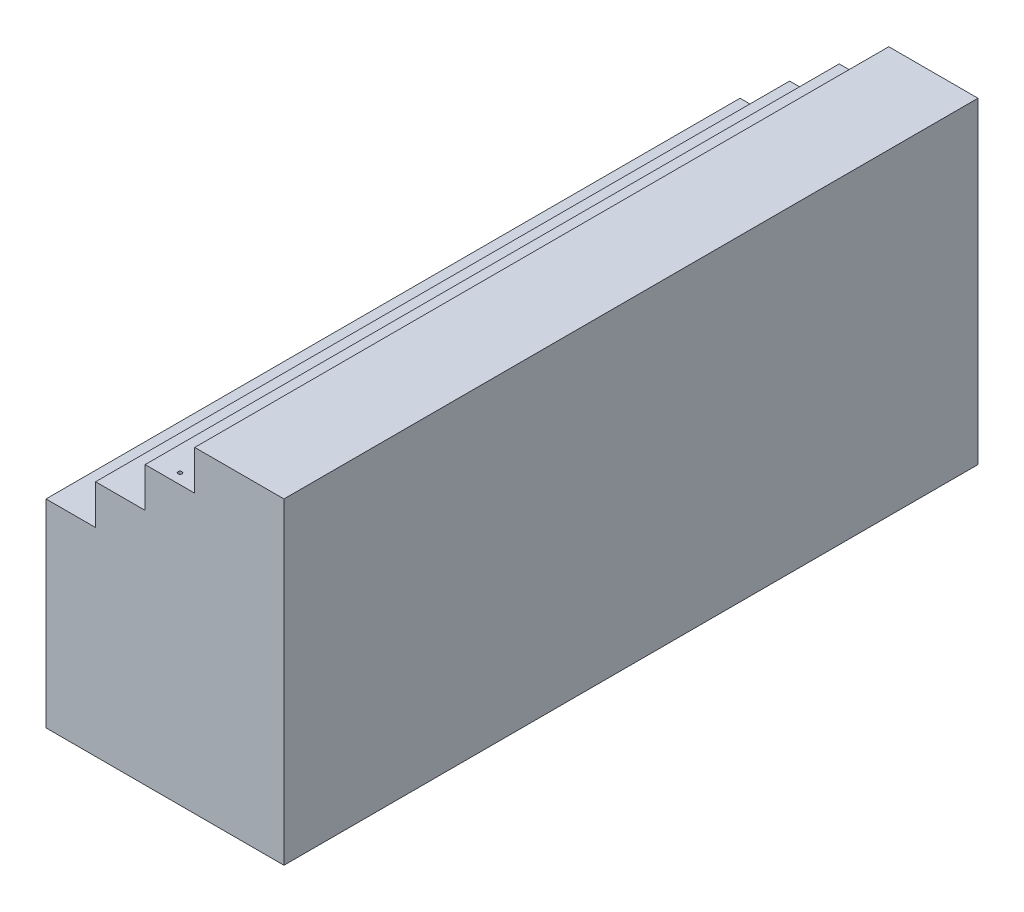
from build123d import *

# Parameters (mm, degrees)
SKETCH_1_W           = 250
SKETCH_1_H           = 3500
EXTRUDE_1_DEPTH      = 1000
SKETCH_1_3_W         = 250
SKETCH_1_3_H         = 3500
EXTRUDE_2_DEPTH      = 1200
SKETCH_1_4_W         = 250
SKETCH_1_4_H         = 3500
EXTRUDE_3_DEPTH      = 1400
SKETCH_1_5_W         = 390
SKETCH_1_5_H         = 3500
EXTRUDE_4_DEPTH      = 1600
SKETCH_1_6_W         = 60
SKETCH_1_6_H         = 3500
EXTRUDE_5_DEPTH      = 1600
SKETCH_2_R           = 10
SKETCH_2_R_2         = 12.335954766
CUT_EXTRUDE_1_DEPTH  = 230
SKETCH_10_R          = 10
SKETCH_10_R_2        = 12.335954766
CUT_EXTRUDE_8_DEPTH  = 230
SKETCH_16_R          = 10
SKETCH_16_R_2        = 12.335954766
CUT_EXTRUDE_14_DEPTH = 230


with BuildPart() as part:
    # Эскиз1 → Бобышка-Вытянуть1 (new body)
    with BuildSketch(Plane(origin=(0, 0, 0), x_dir=(1, 0, 0), z_dir=(0, 1, 0))):
        with Locations((125, 1750)):
            Rectangle(SKETCH_1_W, SKETCH_1_H)
    extrude(amount=EXTRUDE_1_DEPTH)

    # Эскиз1<3> → Бобышка-Вытянуть2 (add)
    with BuildSketch(Plane(origin=(0, 0, 0), x_dir=(1, 0, 0), z_dir=(0, 1, 0))):
        with Locations((375, 1750)):
            Rectangle(SKETCH_1_3_W, SKETCH_1_3_H)
    extrude(amount=EXTRUDE_2_DEPTH)

    # Эскиз1<4> → Бобышка-Вытянуть3 (add)
    with BuildSketch(Plane(origin=(0, 0, 0), x_dir=(1, 0, 0), z_dir=(0, 1, 0))):
        with Locations((625, 1750)):
            Rectangle(SKETCH_1_4_W, SKETCH_1_4_H)
    extrude(amount=EXTRUDE_3_DEPTH)

    # Эскиз1<5> → Бобышка-Вытянуть4 (add)
    with BuildSketch(Plane(origin=(0, 0, 0), x_dir=(1, 0, 0), z_dir=(0, 1, 0))):
        with Locations((945, 1750)):
            Rectangle(SKETCH_1_5_W, SKETCH_1_5_H)
    extrude(amount=EXTRUDE_4_DEPTH)

    # Эскиз1<6> → Бобышка-Вытянуть5 (add)
    with BuildSketch(Plane(origin=(0, 0, 0), x_dir=(1, 0, 0), z_dir=(0, 1, 0))):
        with Locations((1170, 1750)):
            Rectangle(SKETCH_1_6_W, SKETCH_1_6_H)
    extrude(amount=EXTRUDE_5_DEPTH)

    # Эскиз2 → Вырез-Вытянуть1 (cut)
    with BuildSketch(Plane(origin=(0, 1400, 0), x_dir=(1, 0, 0), z_dir=(0, 1, 0))):
        with Locations((625, 3357.152132265)):
            Circle(SKETCH_2_R)
        with Locations((625, 3243.136997035)):
            Circle(SKETCH_2_R)
        with Locations((625, 3145.792962986)):
            Circle(SKETCH_2_R)
        with Locations((625, 3016.463867162)):
            Circle(SKETCH_2_R)
        with Locations((625, 2886.892438707)):
            Circle(SKETCH_2_R)
        with Locations((625, 2776.185031262)):
            Circle(SKETCH_2_R)
        with Locations((625, 2652.112531743)):
            Circle(SKETCH_2_R)
        with Locations((625, 2528.615192208)):
            Circle(SKETCH_2_R)
        with Locations((625, 2426.866506998)):
            Circle(SKETCH_2_R)
        with Locations((625, 2323.054011053)):
            Circle(SKETCH_2_R)
        with Locations((625, 2236.363113826)):
            Circle(SKETCH_2_R_2)
    extrude(amount=-CUT_EXTRUDE_1_DEPTH, mode=Mode.SUBTRACT)

    # Эскиз10 → Вырез-Вытянуть8 (cut)
    with BuildSketch(Plane(origin=(0, 1400, 0), x_dir=(1, 0, 0), z_dir=(0, 1, 0))):
        with Locations((632.852016255, 2116.617341228)):
            Circle(SKETCH_10_R)
        with Locations((632.852016255, 2002.602205997)):
            Circle(SKETCH_10_R)
        with Locations((632.852016255, 1905.258171949)):
            Circle(SKETCH_10_R)
        with Locations((632.852016255, 1775.929076125)):
            Circle(SKETCH_10_R)
        with Locations((632.852016255, 1646.35764767)):
            Circle(SKETCH_10_R)
        with Locations((632.852016255, 1535.650240224)):
            Circle(SKETCH_10_R)
        with Locations((632.852016255, 1411.577740705)):
            Circle(SKETCH_10_R)
        with Locations((632.852016255, 1288.08040117)):
            Circle(SKETCH_10_R)
        with Locations((632.852016255, 1186.33171596)):
            Circle(SKETCH_10_R)
        with Locations((632.852016255, 1082.519220016)):
            Circle(SKETCH_10_R)
        with Locations((632.852016255, 995.828322788)):
            Circle(SKETCH_10_R_2)
    extrude(amount=-CUT_EXTRUDE_8_DEPTH, mode=Mode.SUBTRACT)

    # Эскиз16 → Вырез-Вытянуть14 (cut)
    with BuildSketch(Plane(origin=(0, 1400, 0), x_dir=(1, 0, 0), z_dir=(0, 1, 0))):
        with Locations((623.672758158, 880.722913646)):
            Circle(SKETCH_16_R)
        with Locations((623.672758158, 766.707778415)):
            Circle(SKETCH_16_R)
        with Locations((623.672758158, 669.363744367)):
            Circle(SKETCH_16_R)
        with Locations((623.672758158, 540.034648543)):
            Circle(SKETCH_16_R)
        with Locations((623.672758158, 410.463220088)):
            Circle(SKETCH_16_R)
        with Locations((623.672758158, 299.755812642)):
            Circle(SKETCH_16_R)
        with Locations((623.672758158, 175.683313124)):
            Circle(SKETCH_16_R)
        with Locations((623.672758158, 52.185973589)):
            Circle(SKETCH_16_R)
        with Locations((623.672758158, -49.562711622)):
            Circle(SKETCH_16_R)
        with Locations((623.672758158, -153.375207566)):
            Circle(SKETCH_16_R)
        with Locations((623.672758158, -240.066104793)):
            Circle(SKETCH_16_R_2)
    extrude(amount=-CUT_EXTRUDE_14_DEPTH, mode=Mode.SUBTRACT)


solid = part.part
